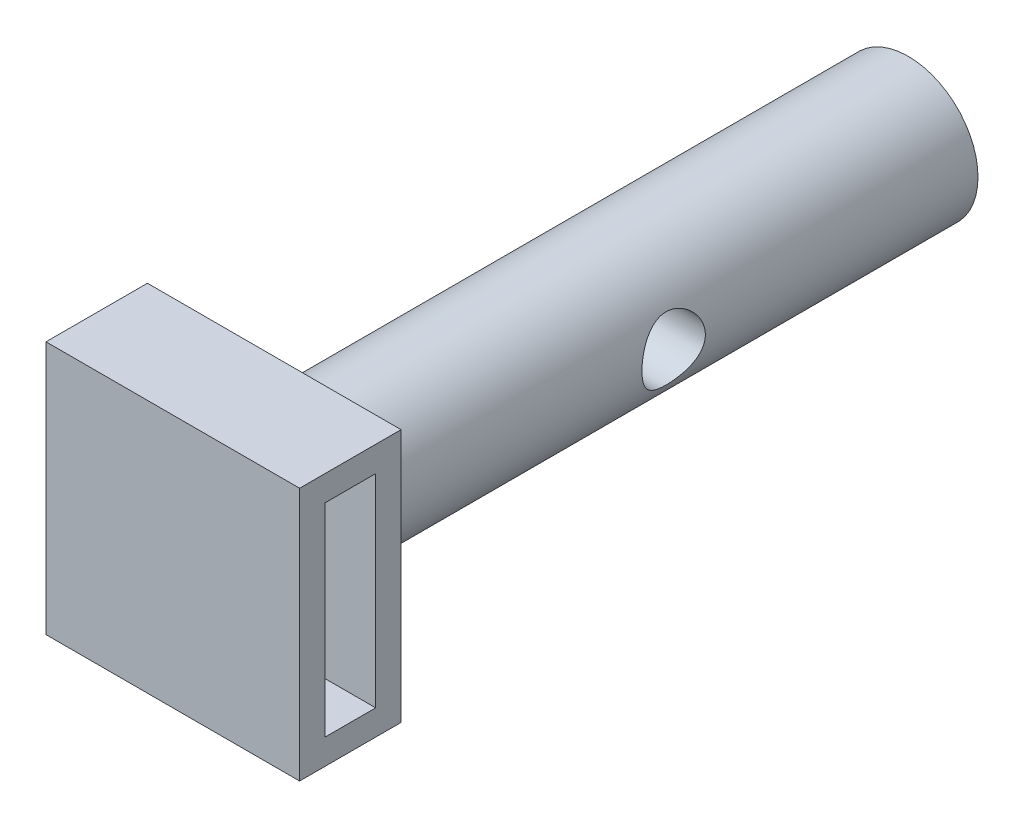
from build123d import *

# Parameters (mm, degrees)
SKETCH2_R               = 2.75
SKETCH3_R               = 2.75
SKETCH3_7_W             = 10
SKETCH3_7_H             = 10
BOSS_EXTRUDE4_DEPTH     = 4
CUT_EXTRUDE2_DEPTH      = 32.080540536
CUT_EXTRUDE2_DEPTH_BACK = 32.080540536
SKETCH8_W               = 2
SKETCH8_H               = 8
FILLET1_R               = 1
CUT_EXTRUDE4_DEPTH      = 30.849623113
CUT_EXTRUDE4_DEPTH_BACK = 30.849623113
SKETCH11_R              = 1.25


with BuildPart() as part:
    # Sketch2 → Loft1 section 0
    with BuildSketch(Plane.XY):
        Circle(SKETCH2_R)
    # Sketch3 → Loft1 section 1
    with BuildSketch(Plane.XY.offset(25)):
        Circle(SKETCH3_R)
    loft()

    # Sketch3<7> → Boss-Extrude4 (add)
    with BuildSketch(Plane.XY.offset(25)):
        Rectangle(SKETCH3_7_W, SKETCH3_7_H)
    extrude(amount=BOSS_EXTRUDE4_DEPTH)

    # Sketch8 → Cut-Extrude2 (cut, two sides: drawn at the far end of the back side and taken through both)
    with BuildSketch(Plane(origin=(5, 0, 0), x_dir=(0, 0, -1), z_dir=(1, 0, 0)).offset(-CUT_EXTRUDE2_DEPTH_BACK)):
        with Locations((-27, 0)):
            Rectangle(SKETCH8_W, SKETCH8_H)
    extrude(amount=CUT_EXTRUDE2_DEPTH + CUT_EXTRUDE2_DEPTH_BACK, mode=Mode.SUBTRACT)

    # Fillet1
    fillet1_edges = [part.edges().sort_by_distance(p)[0] for p in [
        (-2.75, 0, 25),
    ]]
    fillet(fillet1_edges, radius=FILLET1_R)

    # Sketch11 → Cut-Extrude4 (cut, two sides: drawn at the far end of the back side and taken through both)
    with BuildSketch(Plane(origin=(0, 0, 0), x_dir=(0, 0, -1), z_dir=(1, 0, 0)).offset(-CUT_EXTRUDE4_DEPTH_BACK)):
        with Locations((-12, 0)):
            Circle(SKETCH11_R)
    extrude(amount=CUT_EXTRUDE4_DEPTH + CUT_EXTRUDE4_DEPTH_BACK, mode=Mode.SUBTRACT)


solid = part.part
